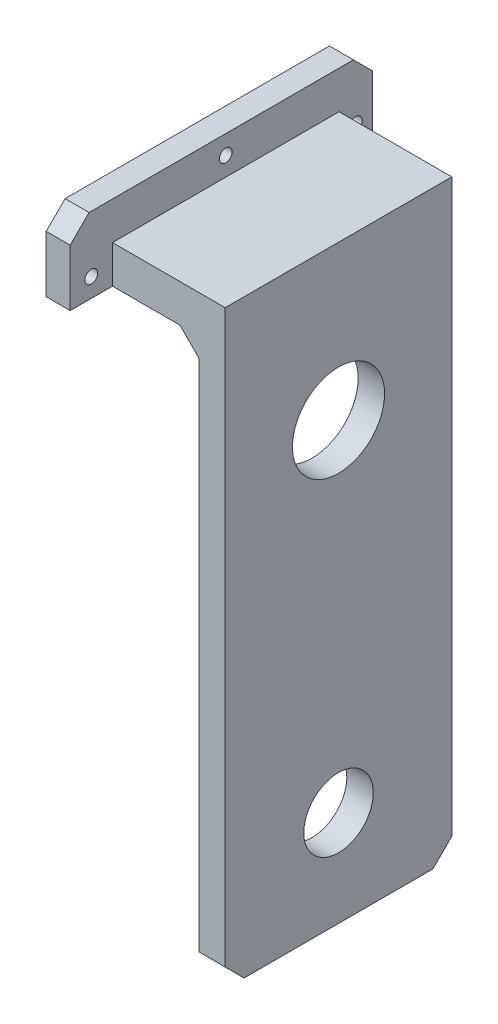
from build123d import *

# Parameters (mm, degrees)
SKETCH1_W           = 30
SKETCH1_H           = 5
BOSS_EXTRUDE1_DEPTH = 18.1
SKETCH2_W           = 40
SKETCH2_H           = 10
SKETCH2_R           = 0.85
BOSS_EXTRUDE2_DEPTH = 3.175
SKETCH3_W           = 3.5
SKETCH3_H           = 30
BOSS_EXTRUDE3_DEPTH = 73.1
CHAMFER1_SIZE       = 2.5
CHAMFER2_SIZE       = 2.5
CUT_EXTRUDE1_REACH  = 82.419
SKETCH4_R           = 6.1
SKETCH4_R_2         = 4.6
CHAMFER3_SIZE       = 2.5


with BuildPart() as part:
    # Sketch1 → Boss-Extrude1 (new body)
    with BuildSketch(Plane(origin=(0, 0, 0), x_dir=(0, 0, -1), z_dir=(1, 0, 0))):
        Rectangle(SKETCH1_W, SKETCH1_H)
    extrude(amount=BOSS_EXTRUDE1_DEPTH)

    # Sketch2 → Boss-Extrude2 (add)
    with BuildSketch(Plane.ZY):
        with Locations((0.597390222, 2.5)):
            Rectangle(SKETCH2_W, SKETCH2_H)
        with Locations((-17.201304889, 0)):
            Circle(SKETCH2_R, mode=Mode.SUBTRACT)
        with Locations((17.798695111, 0)):
            Circle(SKETCH2_R, mode=Mode.SUBTRACT)
        with Locations((0, 5)):
            Circle(SKETCH2_R, mode=Mode.SUBTRACT)
    extrude(amount=-BOSS_EXTRUDE2_DEPTH)

    # Sketch3 → Boss-Extrude3 (add)
    with BuildSketch(Plane.XZ.offset(2.5)):
        with Locations((16.35, 0)):
            Rectangle(SKETCH3_W, SKETCH3_H)
    extrude(amount=BOSS_EXTRUDE3_DEPTH)

    # Chamfer1
    chamfer1_edges = [part.edges().sort_by_distance(p)[0] for p in [
        (14.6, -2.5, 0),
    ]]
    chamfer(chamfer1_edges, length=CHAMFER1_SIZE)

    # Chamfer2
    chamfer2_edges = [part.edges().sort_by_distance(p)[0] for p in [
        (1.5875, 7.5, -19.402609778),
        (1.5875, 7.5, 20.597390222),
    ]]
    chamfer(chamfer2_edges, length=CHAMFER2_SIZE)

    # Sketch4 → Cut-Extrude1 (cut, up to next)
    with BuildSketch(Plane(origin=(18.1, 0, 0), x_dir=(0, 0, -1), z_dir=(1, 0, 0)), mode=Mode.PRIVATE) as cut_extrude1_sk1:
        with Locations((5e-09, -17.9)):
            Circle(SKETCH4_R)
    cut_extrude1_tool1 = extrude(cut_extrude1_sk1.sketch, amount=-CUT_EXTRUDE1_REACH, mode=Mode.PRIVATE) & part.part
    # Sketch4 → Cut-Extrude1 (cut, up to next)
    with BuildSketch(Plane(origin=(18.1, 0, 0), x_dir=(0, 0, -1), z_dir=(1, 0, 0)), mode=Mode.PRIVATE) as cut_extrude1_sk2:
        with Locations((5e-09, -62.9)):
            Circle(SKETCH4_R_2)
    cut_extrude1_tool2 = extrude(cut_extrude1_sk2.sketch, amount=-CUT_EXTRUDE1_REACH, mode=Mode.PRIVATE) & part.part
    add(cut_extrude1_tool1.solids().sort_by_distance((18.1, -17.9, 0))[0], mode=Mode.SUBTRACT)
    add(cut_extrude1_tool2.solids().sort_by_distance((18.1, -62.9, 0))[0], mode=Mode.SUBTRACT)

    # Chamfer3
    chamfer3_edges = [part.edges().sort_by_distance(p)[0] for p in [
        (16.35, -75.6, -15),
        (16.35, -75.6, 15),
    ]]
    chamfer(chamfer3_edges, length=CHAMFER3_SIZE)


solid = part.part
